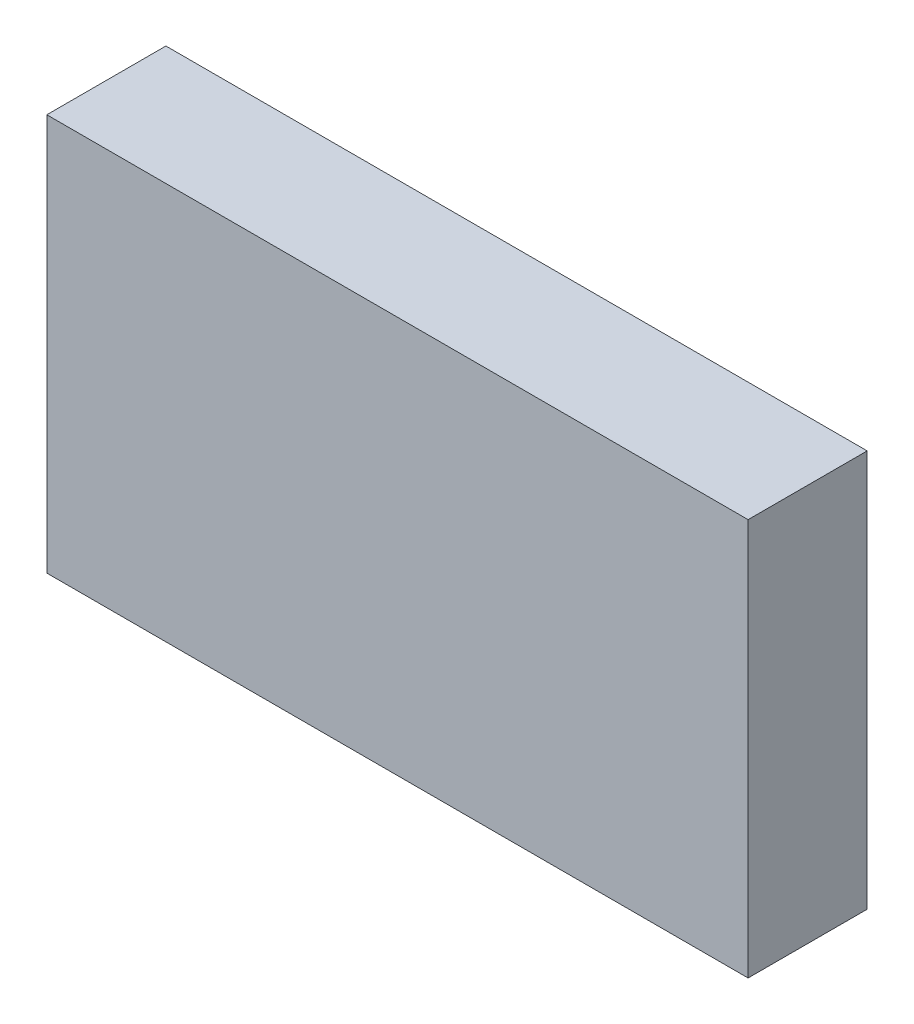
from build123d import *

# Parameters (mm, degrees)
SKETCH1_W           = 53
SKETCH1_H           = 30
BOSS_EXTRUDE1_DEPTH = 9


with BuildPart() as part:
    # Sketch1 → Boss-Extrude1 (new body)
    with BuildSketch(Plane.XY):
        Rectangle(SKETCH1_W, SKETCH1_H)
    extrude(amount=BOSS_EXTRUDE1_DEPTH)


solid = part.part
